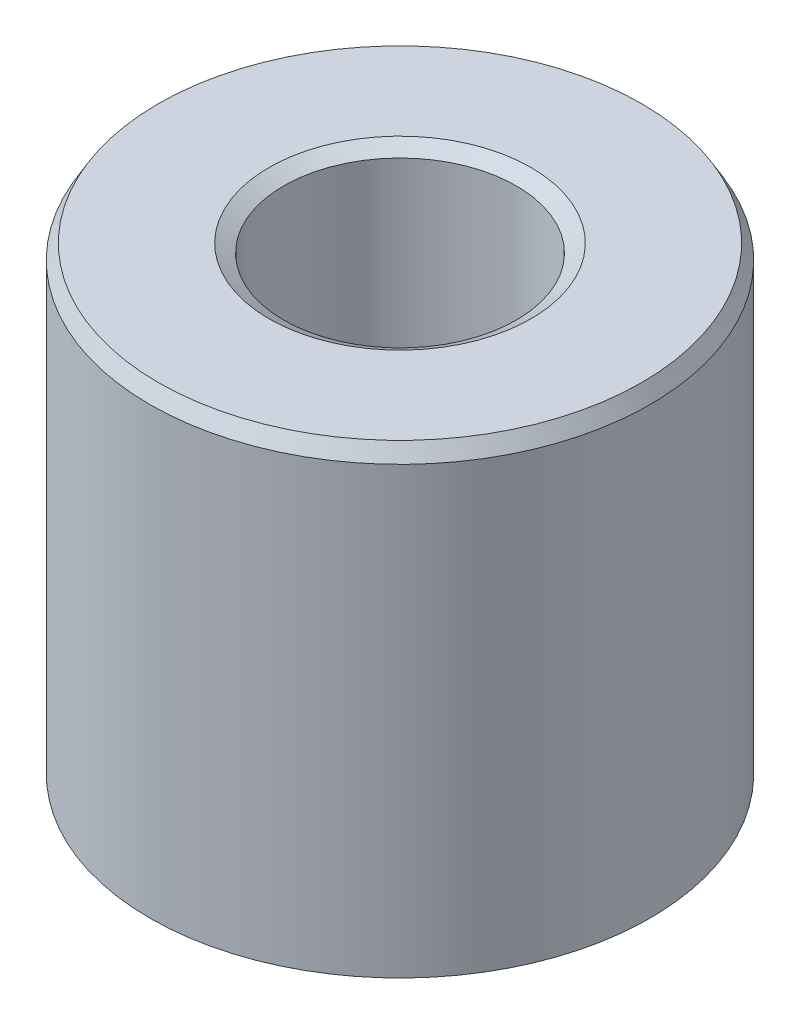
from build123d import *
from OCP.BRepFilletAPI import BRepFilletAPI_MakeChamfer

# Parameters (mm, degrees)
SKETCH1_R           = 40
BOSS_EXTRUDE1_DEPTH = 74.860618498
SKETCH2_R           = 18.601141343
CUT_EXTRUDE1_DEPTH  = 94.830230746
CHAMFER1_SIZE       = 2.358450064
CHAMFER1_SIZE2      = 1.361651779


with BuildPart() as part:
    # Sketch1 → Boss-Extrude1 (new body)
    with BuildSketch(Plane(origin=(0, 0, 0), x_dir=(1, 0, 0), z_dir=(0, 1, 0))):
        Circle(SKETCH1_R)
    extrude(amount=BOSS_EXTRUDE1_DEPTH)

    # Sketch2 → Cut-Extrude1 (cut, through all)
    with BuildSketch(Plane(origin=(0, 0, 0), x_dir=(1, 0, 0), z_dir=(0, 1, 0))):
        Circle(SKETCH2_R)
    extrude(amount=CUT_EXTRUDE1_DEPTH, mode=Mode.SUBTRACT)

    # Chamfer1: one chamfer whose edges measure the first distance from different faces: ONE call of the kernel's chamfer builder (chamfer() names one face for all edges)
    chamfer1_edges_1 = [part.edges().sort_by_distance(p)[0] for p in [
        (-18.601141343, 74.860618498, 0),
    ]]
    chamfer1_side_1 = [part.faces().sort_by_distance(p)[0] for p in [
        (-38.86862915, 74.860618498, 0),
    ]]
    chamfer1_edges_2 = [part.edges().sort_by_distance(p)[0] for p in [
        (-18.601141343, 0, 0),
    ]]
    chamfer1_side_2 = [part.faces().sort_by_distance(p)[0] for p in [
        (-18.601141343, 37.430309249, 0),
    ]]
    chamfer1_edges_3 = [part.edges().sort_by_distance(p)[0] for p in [
        (-40, 0, 0),
    ]]
    chamfer1_side_3 = [part.faces().sort_by_distance(p)[0] for p in [
        (-38.86862915, 0, 0),
    ]]
    chamfer1_edges_4 = [part.edges().sort_by_distance(p)[0] for p in [
        (-40, 74.860618498, 0),
    ]]
    chamfer1_side_4 = [part.faces().sort_by_distance(p)[0] for p in [
        (-40, 37.430309249, 0),
    ]]
    chamfer1 = BRepFilletAPI_MakeChamfer(part.part.solid().wrapped)
    for e in chamfer1_edges_1:
        chamfer1.Add(CHAMFER1_SIZE, CHAMFER1_SIZE2, e.wrapped, chamfer1_side_1[0].wrapped)  # the first distance lies on this face
    for e in chamfer1_edges_2:
        chamfer1.Add(CHAMFER1_SIZE, CHAMFER1_SIZE2, e.wrapped, chamfer1_side_2[0].wrapped)  # the first distance lies on this face
    for e in chamfer1_edges_3:
        chamfer1.Add(CHAMFER1_SIZE, CHAMFER1_SIZE2, e.wrapped, chamfer1_side_3[0].wrapped)  # the first distance lies on this face
    for e in chamfer1_edges_4:
        chamfer1.Add(CHAMFER1_SIZE, CHAMFER1_SIZE2, e.wrapped, chamfer1_side_4[0].wrapped)  # the first distance lies on this face
    add(Compound.cast(chamfer1.Shape()), mode=Mode.REPLACE)


solid = part.part
